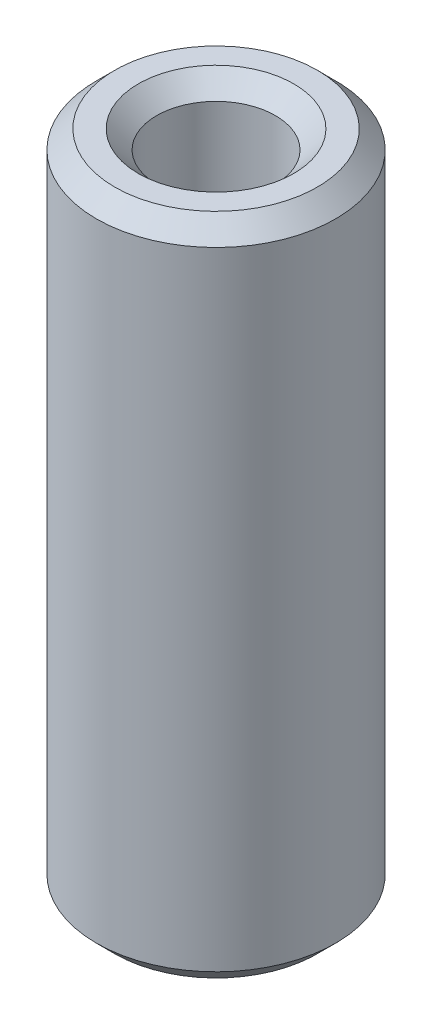
from build123d import *

# Parameters (mm, degrees)
SKETCH1_R           = 25
BOSS_EXTRUDE1_DEPTH = 138.766618635
SKETCH2_R           = 12.414397947
CUT_EXTRUDE1_DEPTH  = 144.199771115
CHAMFER1_SIZE       = 3.830943721


with BuildPart() as part:
    # Sketch1 → Boss-Extrude1 (new body)
    with BuildSketch(Plane(origin=(0, 0, 0), x_dir=(1, 0, 0), z_dir=(0, 1, 0))):
        Circle(SKETCH1_R)
    extrude(amount=BOSS_EXTRUDE1_DEPTH)

    # Sketch2 → Cut-Extrude1 (cut, through all)
    with BuildSketch(Plane(origin=(0, 0, 0), x_dir=(1, 0, 0), z_dir=(0, 1, 0))):
        Circle(SKETCH2_R)
    extrude(amount=CUT_EXTRUDE1_DEPTH, mode=Mode.SUBTRACT)

    # Chamfer1
    chamfer1_edges = [part.edges().sort_by_distance(p)[0] for p in [
        (-12.414397947, 138.766618635, 0),
        (-12.414397947, 0, 0),
        (-25, 0, 0),
        (-25, 138.766618635, 0),
    ]]
    chamfer(chamfer1_edges, length=CHAMFER1_SIZE)


solid = part.part
